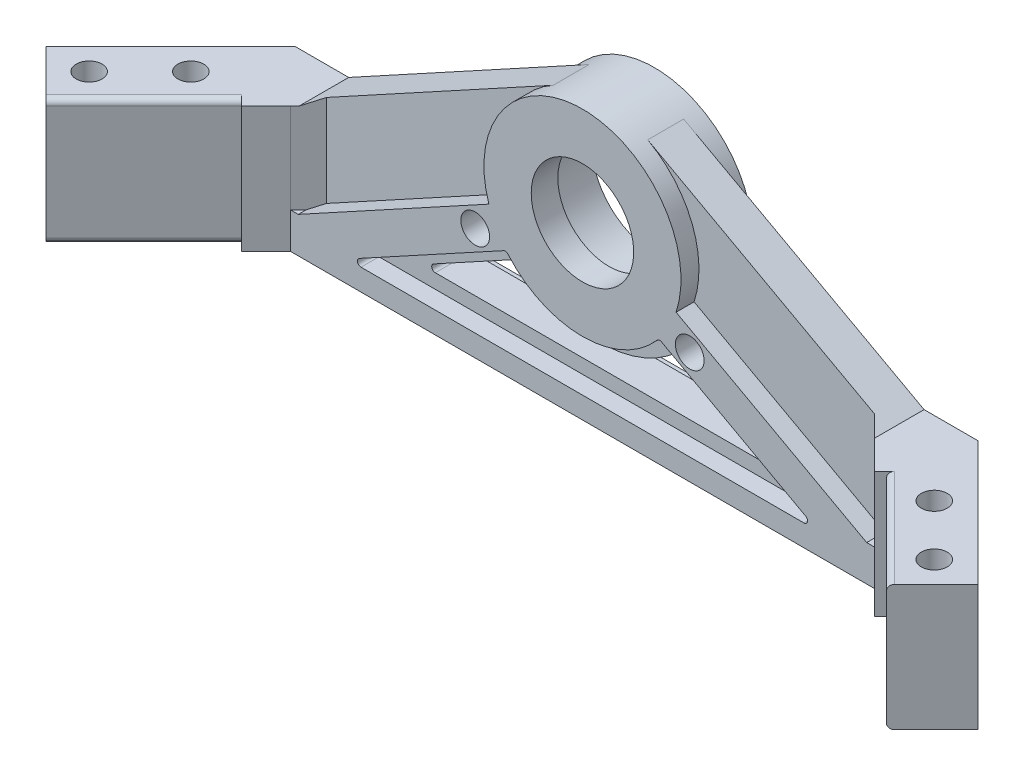
from build123d import *

# Parameters (mm, degrees)
BOSS_EXTRUDE1_DEPTH = 11.1125
BOSS_EXTRUDE2_DEPTH = 12.7
CUT_EXTRUDE2_DEPTH  = 8
CUT_EXTRUDE3_DEPTH  = 96.942967533
SKETCH5_W           = 25.144717139
SKETCH5_H           = 15.875
CUT_EXTRUDE4_DEPTH  = 3.175
CUT_EXTRUDE5_DEPTH  = 96.942967533
SKETCH6_R           = 2.54
CUT_EXTRUDE6_DEPTH  = 96.942967533
CUT_EXTRUDE7_START  = -3.175
CUT_EXTRUDE7_DEPTH  = 3.175
CHAMFER1_SIZE       = 3.175
FILLET1_R           = 0.635
FILLET3_R           = 1.016
SKETCH8_R           = 2.286
CUT_EXTRUDE8_DEPTH  = 93.295392221
CUT_EXTRUDE9_DEPTH  = 0.5


with BuildPart() as part:
    # Sketch3 → Boss-Extrude1 (new, symmetric)
    with BuildSketch(Plane(origin=(0, 0, 0), x_dir=(1, 0, 0), z_dir=(0, 1, 0))):
        Polygon((-56.934473853, -15.948934871), (-65.016704362, -7.866704362), (-82.294717139, -25.144717139), (-74.93090712, -32.508527158), (-74.21248663, -33.226947648), align=None)
        Polygon((-65.016704362, -7.866704362), (-55.873813681, -17.009595043), (-52.371513794, -13.507295156), (-61.514404475, -4.364404475), align=None)
        Polygon((-52.371513794, -13.507295156), (-51.564218639, -12.7), (-17.311249955, -12.7), (0, -12.7), (0, 0), (-17.311249955, 0), (-57.15, 0), (-60.325, -3.175), (-61.514404475, -4.364404475), align=None)
        Polygon((0, 0), (0, -12.7), (17.311249955, -12.7), (51.564218639, -12.7), (52.371513794, -13.507295156), (61.514404475, -4.364404475), (60.325, -3.175), (57.15, 0), (17.311249955, 0), align=None)
        Polygon((61.514404475, -4.364404475), (65.016704362, -7.866704362), (55.873813681, -17.009595043), (52.371513794, -13.507295156), align=None)
        Polygon((65.016704362, -7.866704362), (56.934473853, -15.948934871), (74.21248663, -33.226947648), (74.93090712, -32.508527158), (82.294717139, -25.144717139), align=None)
    extrude(amount=BOSS_EXTRUDE1_DEPTH, both=True)

    # Sketch2 → Boss-Extrude2 (add)
    with BuildSketch(Plane.XY):
        with BuildLine():
            Line((-50.804788276, 11.1125), (50.804788276, 11.1125))
            Line((50.804788276, 11.1125), (8.344749207, 34.318436746))
            ThreePointArc((8.344749207, 34.318436746), (0, 36.45), (-8.344749207, 34.318436746))
            Line((-8.344749207, 34.318436746), (-50.804788276, 11.1125))
        make_face()
    extrude(amount=BOSS_EXTRUDE2_DEPTH)

    # Sketch2<3> → Cut-Extrude2 (cut)
    with BuildSketch(Plane.XY):
        with BuildLine():
            ThreePointArc((0, 30.1), (-11.05, 19.05), (0, 8))
            Line((0, 8), (0, 10))
            ThreePointArc((0, 10), (-9.05, 19.05), (0, 28.1))
            Line((0, 28.1), (0, 30.1))
        make_face()
        with BuildLine():
            Line((0, 10), (0, 8))
            ThreePointArc((0, 8), (7.813529932, 11.236470068), (11.05, 19.05))
            ThreePointArc((11.05, 19.05), (7.813529932, 26.863529932), (0, 30.1))
            Line((0, 30.1), (0, 28.1))
            ThreePointArc((0, 28.1), (6.39931637, 25.44931637), (9.05, 19.05))
            ThreePointArc((9.05, 19.05), (6.39931637, 12.65068363), (0, 10))
        make_face()
        with BuildLine():
            ThreePointArc((0, 28.1), (-9.05, 19.05), (0, 10))
            Line((0, 10), (0, 28.1))
        make_face()
        with BuildLine():
            Line((0, 28.1), (0, 10))
            ThreePointArc((0, 10), (6.39931637, 12.65068363), (9.05, 19.05))
            ThreePointArc((9.05, 19.05), (6.39931637, 25.44931637), (0, 28.1))
        make_face()
    extrude(amount=CUT_EXTRUDE2_DEPTH, mode=Mode.SUBTRACT)

    # Sketch2<5> → Cut-Extrude3 (cut, through all)
    with BuildSketch(Plane.XY):
        with BuildLine():
            ThreePointArc((0, 28.1), (-9.05, 19.05), (0, 10))
            Line((0, 10), (0, 28.1))
        make_face()
        with BuildLine():
            Line((0, 28.1), (0, 10))
            ThreePointArc((0, 10), (6.39931637, 12.65068363), (9.05, 19.05))
            ThreePointArc((9.05, 19.05), (6.39931637, 25.44931637), (0, 28.1))
        make_face()
    extrude(amount=CUT_EXTRUDE3_DEPTH, mode=Mode.SUBTRACT)

    # Sketch5 → Cut-Extrude4 (cut)
    # profile 1 of 5: a face of its own
    with BuildSketch(Plane(origin=(0, 0, 0), x_dir=(-1, 0, 0), z_dir=(0, 0, -1))):
        with Locations((-69.72235857, 3.175)):
            Rectangle(SKETCH5_W, SKETCH5_H)
    # profile 2 of 5: a face of its own
    with BuildSketch(Plane(origin=(0, 0, 0), x_dir=(-1, 0, 0), z_dir=(0, 0, -1))):
        with BuildLine():
            Line((-50.190202202, -4.7625), (-16.534774751, 13.631400187))
            ThreePointArc((-16.534774751, 13.631400187), (-16.178258512, 25.454994263), (-8.344749207, 34.318436746))
            Line((-8.344749207, 34.318436746), (-50.804788276, 11.1125))
            Line((-50.804788276, 11.1125), (-57.15, 11.1125))
            Line((-57.15, 11.1125), (-57.15, -4.7625))
            Line((-57.15, -4.7625), (-50.190202202, -4.7625))
        make_face()
    # profile 3 of 5: a face of its own
    with BuildSketch(Plane(origin=(0, 0, 0), x_dir=(-1, 0, 0), z_dir=(0, 0, -1))):
        with BuildLine():
            Line((50.804788276, 11.1125), (8.344749207, 34.318436746))
            ThreePointArc((8.344749207, 34.318436746), (14.965938597, 27.925848236), (17.4, 19.05))
            ThreePointArc((17.4, 19.05), (17.182332215, 16.306378367), (16.534774751, 13.631400187))
            Line((16.534774751, 13.631400187), (50.190202202, -4.7625))
            Line((50.190202202, -4.7625), (57.15, -4.7625))
            Line((57.15, -4.7625), (57.15, 11.1125))
            Line((57.15, 11.1125), (50.804788276, 11.1125))
        make_face()
    # profile 4 of 5: a face of its own
    with BuildSketch(Plane(origin=(0, 0, 0), x_dir=(-1, 0, 0), z_dir=(0, 0, -1))):
        with Locations((69.72235857, 3.175)):
            Rectangle(SKETCH5_W, SKETCH5_H)
    # profile 5 of 5: a face of its own
    with BuildSketch(Plane(origin=(0, 0, 0), x_dir=(-1, 0, 0), z_dir=(0, 0, -1))):
        with BuildLine():
            ThreePointArc((13.489420874, 8.059298271), (0, 1.65), (-13.489420874, 8.059298271))
            Line((-13.489420874, 8.059298271), (-41.5969936, -7.3025))
            Line((-41.5969936, -7.3025), (41.5969936, -7.3025))
            Line((41.5969936, -7.3025), (13.489420874, 8.059298271))
        make_face()
        with BuildLine():
            Line((31.653276027, -4.7625), (-31.653276027, -4.7625))
            Line((-31.653276027, -4.7625), (-14.022402602, 4.873405723))
            ThreePointArc((-14.022402602, 4.873405723), (0, -0.89), (14.022402602, 4.873405723))
            Line((14.022402602, 4.873405723), (31.653276027, -4.7625))
        make_face(mode=Mode.SUBTRACT)
    extrude(amount=-CUT_EXTRUDE4_DEPTH, mode=Mode.SUBTRACT)

    # Sketch5<3> → Cut-Extrude5 (cut, through all)
    with BuildSketch(Plane(origin=(0, 0, 0), x_dir=(-1, 0, 0), z_dir=(0, 0, -1))):
        with BuildLine():
            ThreePointArc((-14.022402602, 4.873405723), (0, -0.89), (14.022402602, 4.873405723))
            Line((14.022402602, 4.873405723), (31.653276027, -4.7625))
            Line((31.653276027, -4.7625), (-31.653276027, -4.7625))
            Line((-31.653276027, -4.7625), (-14.022402602, 4.873405723))
        make_face()
    extrude(amount=-CUT_EXTRUDE5_DEPTH, mode=Mode.SUBTRACT)

    # Sketch6 → Cut-Extrude6 (cut, through all)
    with BuildSketch(Plane(origin=(0, 0, 0), x_dir=(-1, 0, 0), z_dir=(0, 0, -1))):
        with Locations((-18.945146514, 8.695796817)):
            Circle(SKETCH6_R)
        with Locations((18.945146514, 8.695796817)):
            Circle(SKETCH6_R)
    extrude(amount=-CUT_EXTRUDE6_DEPTH, mode=Mode.SUBTRACT)

    # Sketch7 → Cut-Extrude7 (cut)
    # profile 1 of 3: a face of its own
    with BuildSketch(Plane.XY.offset(12.7).offset(CUT_EXTRUDE7_START)):
        with BuildLine():
            ThreePointArc((13.489420874, 8.059298271), (0, 1.65), (-13.489420874, 8.059298271))
            Line((-13.489420874, 8.059298271), (-41.5969936, -7.3025))
            Line((-41.5969936, -7.3025), (41.5969936, -7.3025))
            Line((41.5969936, -7.3025), (13.489420874, 8.059298271))
        make_face()
        with BuildLine():
            Line((-31.653276027, -4.7625), (-14.022402602, 4.873405723))
            ThreePointArc((-14.022402602, 4.873405723), (0, -0.89), (14.022402602, 4.873405723))
            Line((14.022402602, 4.873405723), (31.653276027, -4.7625))
            Line((31.653276027, -4.7625), (-31.653276027, -4.7625))
        make_face(mode=Mode.SUBTRACT)
    # profile 2 of 3: a face of its own
    with BuildSketch(Plane.XY.offset(12.7).offset(CUT_EXTRUDE7_START)):
        with BuildLine():
            Line((-51.564218639, -4.7625), (-50.190202202, -4.7625))
            Line((-50.190202202, -4.7625), (-16.534774751, 13.631400187))
            ThreePointArc((-16.534774751, 13.631400187), (-16.178258512, 25.454994263), (-8.344749207, 34.318436746))
            Line((-8.344749207, 34.318436746), (-50.804788276, 11.1125))
            Line((-50.804788276, 11.1125), (-51.564218639, 11.1125))
            Line((-51.564218639, 11.1125), (-51.564218639, -4.7625))
        make_face()
    # profile 3 of 3: a face of its own
    with BuildSketch(Plane.XY.offset(12.7).offset(CUT_EXTRUDE7_START)):
        with BuildLine():
            Line((50.804788276, 11.1125), (8.344749207, 34.318436746))
            ThreePointArc((8.344749207, 34.318436746), (14.965938597, 27.925848236), (17.4, 19.05))
            ThreePointArc((17.4, 19.05), (17.182332215, 16.306378367), (16.534774751, 13.631400187))
            Line((16.534774751, 13.631400187), (50.190202202, -4.7625))
            Line((50.190202202, -4.7625), (51.564218639, -4.7625))
            Line((51.564218639, -4.7625), (51.564218639, 11.1125))
            Line((51.564218639, 11.1125), (50.804788276, 11.1125))
        make_face()
    extrude(amount=CUT_EXTRUDE7_DEPTH, mode=Mode.SUBTRACT)

    # Chamfer1
    # the kernel refuses this chamfer: 3.175 mm, written as the material it adds along each edge
    with BuildSketch(Plane(origin=(51.564218639, -4.7625, 9.525), x_dir=(0.027495876610585654, 0, 0.9996219169112968), z_dir=(0, 1, 0))) as chamfer1_piece_1_section:
        Polygon((CHAMFER1_SIZE * 0.999621916911, -CHAMFER1_SIZE * 0.0274958766106), (-CHAMFER1_SIZE * 0.0274958766106, -CHAMFER1_SIZE * 0.999621916911), (0, 0), align=None)
    chamfer1_piece_1 = extrude(amount=24.040093487, mode=Mode.PRIVATE)
    chamfer1_piece_1 = split(chamfer1_piece_1, bisect_by=Plane(origin=(53.914958876, 9.412680033, 10.585049919), z_dir=(-0.47958328775301867, -0.8774963647263762, 0)), keep=Keep.TOP, mode=Mode.PRIVATE)
    add(chamfer1_piece_1)
    with BuildSketch(Plane(origin=(51.564218639, -12.927593487, 9.525), x_dir=(0.027495876610585654, 0, 0.9996219169112968), z_dir=(0, 1, 0))) as chamfer1_piece_2_section:
        Polygon((CHAMFER1_SIZE * 0.999621916911, -CHAMFER1_SIZE * 0.0274958766106), (-CHAMFER1_SIZE * 0.0274958766106, -CHAMFER1_SIZE * 0.999621916911), (0, 0), align=None)
    chamfer1_piece_2 = extrude(amount=24.040093487, mode=Mode.PRIVATE)
    chamfer1_piece_2 = split(chamfer1_piece_2, bisect_by=Plane(origin=(51.262556983, 10.862312956, 10.991411226), z_dir=(0.47958328775301867, 0.8774963647263762, 0)), keep=Keep.TOP, mode=Mode.PRIVATE)
    add(chamfer1_piece_2)
    with BuildSketch(Plane(origin=(-51.564218639, 11.1125, 9.525), x_dir=(0.9996219169112966, 0, -0.02749587661058624), z_dir=(0, -1, 0))) as chamfer1_piece_3_section:
        Polygon((CHAMFER1_SIZE * 0.999621916911, CHAMFER1_SIZE * 0.0274958766106), (-CHAMFER1_SIZE * 0.0274958766106, CHAMFER1_SIZE * 0.999621916911), (0, 0), align=None)
    chamfer1_piece_3 = extrude(amount=24.040093487, mode=Mode.PRIVATE)
    chamfer1_piece_3 = split(chamfer1_piece_3, bisect_by=Plane(origin=(-44.440484715, -1.620072832, 10.991411226), z_dir=(-0.47958328775301895, 0.877496364726376, 0)), keep=Keep.TOP, mode=Mode.PRIVATE)
    add(chamfer1_piece_3)
    with BuildSketch(Plane(origin=(-51.564218639, 19.277593487, 9.525), x_dir=(0.9996219169112966, 0, -0.02749587661058624), z_dir=(0, -1, 0))) as chamfer1_piece_4_section:
        Polygon((CHAMFER1_SIZE * 0.999621916911, CHAMFER1_SIZE * 0.0274958766106), (-CHAMFER1_SIZE * 0.0274958766106, CHAMFER1_SIZE * 0.999621916911), (0, 0), align=None)
    chamfer1_piece_4 = extrude(amount=32.205186974, mode=Mode.PRIVATE)
    chamfer1_piece_4 = split(chamfer1_piece_4, bisect_by=Plane(origin=(-49.73589879, 11.696686504, 10.128892409), z_dir=(0.47958328775301867, -0.8774963647263762, 0)), keep=Keep.TOP, mode=Mode.PRIVATE)
    chamfer1_piece_4 = split(chamfer1_piece_4, bisect_by=Plane(origin=(-42.913826522, -0.785699284, 10.128892409), z_dir=(-0.47958328775301895, 0.877496364726376, 0)), keep=Keep.TOP, mode=Mode.PRIVATE)
    add(chamfer1_piece_4)
    with BuildSketch(Plane(origin=(-59.729312125, -4.7625, 9.525), x_dir=(0, 0.9996219169112968, -0.027495876610586195), z_dir=(1, 0, 0))) as chamfer1_piece_5_section:
        Polygon((CHAMFER1_SIZE * 0.999621916911, CHAMFER1_SIZE * 0.0274958766106), (-CHAMFER1_SIZE * 0.0274958766106, CHAMFER1_SIZE * 0.999621916911), (0, 0), align=None)
    chamfer1_piece_5 = extrude(amount=17.70420341, mode=Mode.PRIVATE)
    chamfer1_piece_5 = split(chamfer1_piece_5, bisect_by=Plane(origin=(-49.815745478, -3.522292213, 10.951526839), z_dir=(-0.7071067811865481, 0, -0.707106781186547)), keep=Keep.TOP, mode=Mode.PRIVATE)
    add(chamfer1_piece_5)

    # Fillet1
    fillet1_edges = [part.edges().sort_by_distance(p)[0] for p in [
        (13.489420874, 8.059298271, 1.5875),
        (-13.489420874, 8.059298271, 1.5875),
        (-41.5969936, -7.3025, 1.5875),
        (41.5969936, -7.3025, 1.5875),
        (14.022402602, 4.873405723, 6.35),
        (31.653276027, -4.7625, 6.35),
        (-31.653276027, -4.7625, 6.35),
        (-14.022402602, 4.873405723, 6.35),
        (-13.489420874, 8.059298271, 11.1125),
        (13.489420874, 8.059298271, 11.1125),
        (41.5969936, -7.3025, 11.1125),
        (-41.5969936, -7.3025, 11.1125),
    ]]
    fillet(fillet1_edges, radius=FILLET1_R)

    # Fillet3
    fillet3_edges = [part.edges().sort_by_distance(p)[0] for p in [
        (65.573480242, -11.1125, 24.587941259),
        (-65.573480242, -11.1125, 24.587941259),
        (65.573480242, 11.1125, 24.587941259),
        (-65.573480242, 11.1125, 24.587941259),
    ]]
    fillet(fillet3_edges, radius=FILLET3_R)

    # Sketch8 → Cut-Extrude8 (cut, through all)
    with BuildSketch(Plane(origin=(0, 11.1125, 0), x_dir=(1, 0, 0), z_dir=(0, 1, 0))):
        with Locations(Location((74.625578412, -25.198598676, 0), (0, 0, 270))):
            Circle(SKETCH8_R)
        with Locations(Location((-74.625578412, -25.198598676, 0), (0, 0, 270))):
            Circle(SKETCH8_R)
        with Locations(Location((65.645322291, -16.218342555, 0), (0, 0, 270))):
            Circle(SKETCH8_R)
        with Locations(Location((-65.645322291, -16.218342555, 0), (0, 0, 90))):
            Circle(SKETCH8_R)
    extrude(amount=-CUT_EXTRUDE8_DEPTH, mode=Mode.SUBTRACT)

    # Sketch9 → Cut-Extrude9 (cut)
    # profile 1 of 5: a face of its own
    with BuildSketch(Plane.XZ.offset(11.1125)):
        with BuildLine():
            Line((6.955128205, 5.655889423), (6.573717949, 5.452564103))
            add(Edge.make_bspline(
                [(6.573717949, 5.452564103), (6.545922437, 5.498605223), (6.492797515, 5.586602559), (6.405563696, 5.705145418), (6.318829653, 5.806231322), (6.231739217, 5.889758205), (6.143082637, 5.95438438), (6.053764997, 6.001091066), (5.963227276, 6.030447771), (5.9020118, 6.034100411), (5.871895032, 6.035897436)],
                knots=[0, 0, 0, 0, 1.354943589, 2.589672558, 3.704607527, 4.708856974, 5.624398268, 6.459549776, 7.242129862, 8, 8, 8, 8], degree=3))
            add(Edge.make_bspline(
                [(5.871895032, 6.035897436), (5.843777409, 6.034998249), (5.788084486, 6.03321722), (5.706289617, 6.017626176), (5.626860085, 5.99419681), (5.551935483, 5.959511514), (5.48244247, 5.918382044), (5.420674582, 5.869797955), (5.368082166, 5.814645054), (5.325239521, 5.753088186), (5.291507213, 5.688001962), (5.267412618, 5.620080583), (5.252956595, 5.549928839), (5.250989532, 5.502409986), (5.25, 5.478505609)],
                knots=[0, 0, 0, 0, 1.088711937, 2.156425153, 3.216543554, 4.290691142, 5.346933412, 6.339926723, 7.326538423, 8.288906172, 9.236802047, 10.159214894, 11.073992371, 12, 12, 12, 12], degree=3))
            add(Edge.make_bspline(
                [(5.25, 5.478505609), (5.251289441, 5.451237129), (5.253897944, 5.396073728), (5.277544855, 5.314729095), (5.312451573, 5.233254329), (5.346112616, 5.182849411), (5.363581731, 5.156690705)],
                knots=[0, 0, 0, 0, 0.942144539, 1.905933023, 2.913239343, 4, 4, 4, 4], degree=3))
            add(Edge.make_bspline(
                [(5.363581731, 5.156690705), (5.378599068, 5.137617448), (5.410211837, 5.097466622), (5.463771743, 5.037071303), (5.526108213, 4.973940726), (5.598480894, 4.909395911), (5.677065406, 4.839348386), (5.765885722, 4.768357575), (5.862751255, 4.693916401), (5.930689868, 4.644038805), (5.965845353, 4.618229167)],
                knots=[0, 0, 0, 0, 0.718605451, 1.5127255, 2.388525841, 3.34361075, 4.383114545, 5.504804886, 6.708837455, 8, 8, 8, 8], degree=3))
            add(Edge.make_bspline(
                [(5.965845353, 4.618229167), (6.00168954, 4.592171602), (6.070464497, 4.542174431), (6.167362407, 4.468878347), (6.254240814, 4.401295296), (6.3304335, 4.339372455), (6.395949126, 4.282571618), (6.450649678, 4.231125865), (6.496181868, 4.186447001), (6.520649569, 4.156384964), (6.531650641, 4.14286859)],
                knots=[0, 0, 0, 0, 1.435833971, 2.754963323, 3.936484598, 5.002077172, 5.935979083, 6.744956812, 7.435712417, 8, 8, 8, 8], degree=3))
            add(Edge.make_bspline(
                [(6.531650641, 4.14286859), (6.547710719, 4.122117406), (6.579262034, 4.081350037), (6.61920709, 4.015956536), (6.653578917, 3.949707187), (6.681889214, 3.881988561), (6.703827988, 3.813016997), (6.718920828, 3.742550617), (6.729567054, 3.670869327), (6.730367062, 3.622441786), (6.730769231, 3.598096955)],
                knots=[0, 0, 0, 0, 1.064105702, 2.090521257, 3.104283852, 4.09061442, 5.065433238, 6.036507983, 7.012940167, 8, 8, 8, 8], degree=3))
            add(Edge.make_bspline(
                [(6.730769231, 3.598096955), (6.729515083, 3.560126606), (6.727031963, 3.484948093), (6.704399939, 3.375068313), (6.668607851, 3.26994227), (6.617838539, 3.171328353), (6.554959306, 3.080088965), (6.479870762, 2.998403207), (6.392434284, 2.927813249), (6.294689139, 2.868139824), (6.189328785, 2.819749269), (6.078360338, 2.785257467), (5.963128198, 2.764347606), (5.884835503, 2.761630248), (5.845252404, 2.76025641)],
                knots=[0, 0, 0, 0, 1.004538361, 1.98891246, 2.957754601, 3.937604432, 4.916182936, 5.884154884, 6.865254872, 7.882148152, 8.909646262, 9.927556077, 10.952217026, 12, 12, 12, 12], degree=3))
            add(Edge.make_bspline(
                [(5.845252404, 2.76025641), (5.800288489, 2.761765646), (5.711198198, 2.764756006), (5.58029896, 2.787799883), (5.45446477, 2.825234465), (5.353568286, 2.868466228), (5.275055104, 2.912290321), (5.215686682, 2.951924562), (5.154833361, 2.996764375), (5.09442727, 3.049062555), (5.032112714, 3.106283691), (4.9710811, 3.171539686), (4.907469941, 3.241090211), (4.86692652, 3.291248304), (4.846153846, 3.316947115)],
                knots=[0, 0, 0, 0, 1.360687177, 2.696028959, 4.010076158, 5.328383209, 6.009416266, 6.72960499, 7.488083515, 8.296188009, 9.147227534, 10.04798982, 10.999875445, 12, 12, 12, 12], degree=3))
            Line((4.846153846, 3.316947115), (5.212139423, 3.567948718))
            add(Edge.make_bspline(
                [(5.212139423, 3.567948718), (5.231197788, 3.547515179), (5.267953877, 3.508106922), (5.322642771, 3.45291865), (5.373784064, 3.403079657), (5.421450494, 3.358595495), (5.466336542, 3.319984295), (5.508000192, 3.286910753), (5.546973362, 3.260282729), (5.593160244, 3.230943128), (5.651920246, 3.204105222), (5.723895671, 3.180794058), (5.798937681, 3.16714817), (5.849638961, 3.165128681), (5.875400641, 3.164102564)],
                knots=[0, 0, 0, 0, 1.253255604, 2.417037033, 3.484535688, 4.456276324, 5.340879413, 6.139846054, 6.840628373, 7.457335203, 8.592193832, 9.725986821, 10.844557802, 12, 12, 12, 12], degree=3))
            add(Edge.make_bspline(
                [(5.875400641, 3.164102564), (5.902885124, 3.165396572), (5.956317203, 3.167912228), (6.032932005, 3.189110321), (6.103119698, 3.223200893), (6.165194449, 3.27097975), (6.217718177, 3.329639699), (6.255574284, 3.399162998), (6.277829561, 3.478036176), (6.280604327, 3.533445496), (6.282051282, 3.562339744)],
                knots=[0, 0, 0, 0, 1.033786987, 2.00976631, 2.970458119, 3.95651055, 4.942051941, 5.915168215, 6.91282465, 8, 8, 8, 8], degree=3))
            add(Edge.make_bspline(
                [(6.282051282, 3.562339744), (6.28149088, 3.581062134), (6.28037143, 3.618461629), (6.272009308, 3.67382967), (6.256922644, 3.72753238), (6.23645815, 3.780017787), (6.209395004, 3.831703254), (6.175597302, 3.882906129), (6.134357789, 3.933943781), (6.102846717, 3.966210779), (6.086438301, 3.983012821)],
                knots=[0, 0, 0, 0, 0.941102048, 1.879927795, 2.806320176, 3.740133313, 4.70706341, 5.733547381, 6.819814909, 8, 8, 8, 8], degree=3))
            add(Edge.make_bspline(
                [(6.086438301, 3.983012821), (6.078121626, 3.990836739), (6.059033112, 4.008794272), (6.024022728, 4.036292581), (5.981368032, 4.070768116), (5.930477678, 4.111658174), (5.869678278, 4.156742774), (5.801217798, 4.209033937), (5.723362816, 4.266177574), (5.668576046, 4.306239142), (5.639823718, 4.327263622)],
                knots=[0, 0, 0, 0, 0.485581606, 1.114511607, 1.892484918, 2.819534315, 3.891398566, 5.11240712, 6.484579029, 8, 8, 8, 8], degree=3))
            add(Edge.make_bspline(
                [(5.639823718, 4.327263622), (5.600647247, 4.355810699), (5.524859001, 4.411036014), (5.417274927, 4.494420765), (5.320111394, 4.575739513), (5.231859623, 4.653699656), (5.153297125, 4.728862304), (5.085159515, 4.802258672), (5.025718972, 4.871778844), (4.962356185, 4.960505052), (4.898616052, 5.06962878), (4.843298524, 5.202280536), (4.808089766, 5.335069751), (4.80353079, 5.424082684), (4.801282051, 5.467988782)],
                knots=[0, 0, 0, 0, 1.186639563, 2.29559556, 3.331401308, 4.287832086, 5.178002532, 5.991653193, 6.738845359, 7.415240842, 8.658551622, 9.823054859, 10.926210341, 12, 12, 12, 12], degree=3))
            add(Edge.make_bspline(
                [(4.801282051, 5.467988782), (4.802275506, 5.499122385), (4.804250073, 5.561002801), (4.818566607, 5.652496737), (4.842387021, 5.741426577), (4.876660762, 5.827412615), (4.919396348, 5.91127786), (4.972439298, 5.992227342), (5.035257903, 6.070059394), (5.106262482, 6.144446648), (5.183899032, 6.213576047), (5.267788427, 6.274099775), (5.356348148, 6.325831589), (5.450294329, 6.366808857), (5.548106527, 6.400426022), (5.651087312, 6.423387681), (5.758665045, 6.436656939), (5.831894176, 6.438703864), (5.869090545, 6.43974359)],
                knots=[0, 0, 0, 0, 0.932738639, 1.853889356, 2.767877299, 3.686041414, 4.622558463, 5.584089528, 6.580490983, 7.61578374, 8.662665956, 9.690923261, 10.710750907, 11.729736566, 12.757349726, 13.805636525, 14.885384091, 16, 16, 16, 16], degree=3))
            add(Edge.make_bspline(
                [(5.869090545, 6.43974359), (5.896214412, 6.439141134), (5.949637214, 6.437954545), (6.028947511, 6.430427802), (6.106126309, 6.415961477), (6.181596753, 6.397257975), (6.255405946, 6.373441591), (6.326602693, 6.34297607), (6.396372582, 6.307982208), (6.464315382, 6.267008021), (6.530517733, 6.219030474), (6.595355852, 6.163337979), (6.658453112, 6.09895153), (6.720891134, 6.026707642), (6.781845028, 5.945793723), (6.841172492, 5.856635242), (6.899631031, 5.759519711), (6.936264526, 5.691113712), (6.955128205, 5.655889423)],
                knots=[0, 0, 0, 0, 0.916943493, 1.805999526, 2.689245248, 3.568702553, 4.433092864, 5.307568578, 6.183755457, 7.069823058, 7.986358083, 8.944343836, 9.955449961, 11.030835633, 12.170024038, 13.377301724, 14.649494474, 16, 16, 16, 16], degree=3))
        make_face()
    # profile 2 of 5: a face of its own
    with BuildSketch(Plane.XZ.offset(11.1125)):
        Polygon((4.128205128, 6.35), (4.128205128, 2.85), (3.962039263, 2.85), (1.83974359, 5.509354968), (1.83974359, 2.85), (1.391025641, 2.85), (1.391025641, 6.35), (1.574719551, 6.35), (3.679487179, 3.69765625), (3.679487179, 6.35), align=None)
    # profile 3 of 5: a face of its own
    with BuildSketch(Plane.XZ.offset(11.1125)):
        Polygon((0.043469551, 2.85), (-0.717948718, 2.85), (-0.717948718, 6.35), (-0.269230769, 6.35), (-0.269230769, 3.253846154), (0.269230769, 3.253846154), align=None)
    # profile 4 of 5: a face of its own
    with BuildSketch(Plane.XZ.offset(11.1125)):
        with BuildLine():
            add(Edge.make_bspline(
                [(-1.929487179, 4.601402244), (-1.929820024, 4.545772786), (-1.930466421, 4.437738209), (-1.937473576, 4.280579568), (-1.949475503, 4.133047998), (-1.965186437, 3.99497525), (-1.985981936, 3.866455085), (-2.01210377, 3.747657913), (-2.041666608, 3.638070524), (-2.077057072, 3.537721733), (-2.116884293, 3.445335588), (-2.159279173, 3.358445926), (-2.207248145, 3.277982304), (-2.258445983, 3.202763868), (-2.313138476, 3.132633266), (-2.372968524, 3.069102006), (-2.436199286, 3.01043296), (-2.503346552, 2.957979374), (-2.573759685, 2.911897493), (-2.645716894, 2.870677498), (-2.720506077, 2.837466064), (-2.796608784, 2.808773511), (-2.875043288, 2.787234356), (-2.955710335, 2.771953379), (-3.038153153, 2.761483068), (-3.094018037, 2.760666707), (-3.122095353, 2.76025641)],
                knots=[0, 0, 0, 0, 1.622605109, 3.151162473, 4.587442309, 5.939538287, 7.20372481, 8.383107478, 9.486239959, 10.512528934, 11.483748244, 12.419707751, 13.330476935, 14.213498841, 15.072700274, 15.92158999, 16.756207925, 17.586695167, 18.403499641, 19.2093348, 20.002585959, 20.787710657, 21.579935901, 22.371427536, 23.181490415, 24, 24, 24, 24], degree=3))
            add(Edge.make_bspline(
                [(-3.122095353, 2.76025641), (-3.152731517, 2.761033674), (-3.213201864, 2.762567854), (-3.302787896, 2.771651823), (-3.389864801, 2.78757717), (-3.474185977, 2.81134458), (-3.556619955, 2.83954235), (-3.63604835, 2.875891171), (-3.713266346, 2.917848905), (-3.787678328, 2.966252878), (-3.858415308, 3.020964068), (-3.925441203, 3.081687718), (-3.988267508, 3.148014653), (-4.046907915, 3.220326578), (-4.101416121, 3.2977732), (-4.151425746, 3.381374377), (-4.197578861, 3.470324753), (-4.240034798, 3.565409639), (-4.277149587, 3.667580194), (-4.309407109, 3.777408534), (-4.336484753, 3.895211611), (-4.358892888, 4.021105793), (-4.376144672, 4.154950988), (-4.388881636, 4.296670021), (-4.395532446, 4.44639057), (-4.396790125, 4.548812409), (-4.397435897, 4.601402244)],
                knots=[0, 0, 0, 0, 0.874832558, 1.726764085, 2.568361456, 3.398879789, 4.226201588, 5.053523386, 5.889679481, 6.733707388, 7.585299078, 8.4404393, 9.313717912, 10.191269597, 11.096596538, 12.015593249, 12.970707924, 13.956566593, 14.986800884, 16.072143337, 17.223061702, 18.436511454, 19.721974523, 21.075312687, 22.498281019, 24, 24, 24, 24], degree=3))
            add(Edge.make_bspline(
                [(-4.397435897, 4.601402244), (-4.396782502, 4.653757336), (-4.395510127, 4.755709971), (-4.388966535, 4.904744814), (-4.375857992, 5.045682145), (-4.359906802, 5.178975556), (-4.336868841, 5.303968911), (-4.311081981, 5.421313071), (-4.278377775, 5.530191748), (-4.241956283, 5.631910666), (-4.200730937, 5.726917543), (-4.153785212, 5.815343618), (-4.104592007, 5.899021968), (-4.050060208, 5.976726285), (-3.991471708, 6.048656628), (-3.928478795, 6.115269439), (-3.861485674, 6.17603404), (-3.790212069, 6.231128369), (-3.715479627, 6.279794991), (-3.638364874, 6.322876937), (-3.558372006, 6.358984162), (-3.47592898, 6.388001652), (-3.391043214, 6.411839285), (-3.303435357, 6.427402676), (-3.213482705, 6.437646554), (-3.152739512, 6.439040408), (-3.122095353, 6.43974359)],
                knots=[0, 0, 0, 0, 1.49659969, 2.914373258, 4.262463443, 5.541784011, 6.749918813, 7.89402581, 8.97408983, 9.996834451, 10.981022981, 11.93120719, 12.856888794, 13.753851156, 14.64171265, 15.506454614, 16.371918745, 17.224394982, 18.078544691, 18.918788586, 19.746969722, 20.583674387, 21.415055378, 22.264095942, 23.124258755, 24, 24, 24, 24], degree=3))
            add(Edge.make_bspline(
                [(-3.122095353, 6.43974359), (-3.09379246, 6.439262863), (-3.037736562, 6.438310748), (-2.954962623, 6.428966204), (-2.874322736, 6.413472536), (-2.796083047, 6.391704526), (-2.719785436, 6.364330767), (-2.645951414, 6.33048748), (-2.574212715, 6.290386167), (-2.504974112, 6.244015703), (-2.438313207, 6.192389521), (-2.375492482, 6.134420479), (-2.316719786, 6.07040235), (-2.26121611, 6.000976337), (-2.209744799, 5.925591128), (-2.163065245, 5.843940476), (-2.119409324, 5.756680398), (-2.07933584, 5.66314306), (-2.043193198, 5.562154409), (-2.012518016, 5.452245215), (-1.986781079, 5.333047342), (-1.966139854, 5.20450334), (-1.949205111, 5.067012571), (-1.937551448, 4.920113235), (-1.930454678, 4.763900402), (-1.929815614, 4.656565118), (-1.929487179, 4.601402244)],
                knots=[0, 0, 0, 0, 0.826227461, 1.636402404, 2.428761462, 3.221854935, 4.005495932, 4.793404576, 5.590831925, 6.402844393, 7.224663165, 8.050552332, 8.895728592, 9.760111832, 10.644101474, 11.558317463, 12.504453911, 13.491971134, 14.528097073, 15.634271589, 16.821614375, 18.087186367, 19.434798266, 20.865849934, 22.389264722, 24, 24, 24, 24], degree=3))
        make_face()
        with BuildLine():
            add(Edge.make_bspline(
                [(-2.378205128, 4.6), (-2.378419726, 4.646978143), (-2.378835172, 4.737924313), (-2.383553365, 4.869584142), (-2.392507878, 4.992010362), (-2.402014458, 5.10560144), (-2.417187446, 5.210052574), (-2.43417632, 5.305659219), (-2.455212435, 5.392009987), (-2.479161501, 5.469956862), (-2.506024847, 5.540860229), (-2.535825564, 5.606139939), (-2.566716304, 5.667314607), (-2.601696035, 5.722840453), (-2.637826639, 5.774385586), (-2.677248131, 5.820847469), (-2.719335124, 5.862303347), (-2.777555397, 5.909959052), (-2.852043249, 5.959857009), (-2.944753063, 6.00300953), (-3.038190548, 6.031176958), (-3.101340061, 6.03433403), (-3.132612179, 6.035897436)],
                knots=[0, 0, 0, 0, 1.565050911, 3.029821469, 4.387792543, 5.654509782, 6.826079957, 7.902709307, 8.888453275, 9.784884885, 10.617798265, 11.412307314, 12.174931846, 12.898730956, 13.596561216, 14.270483471, 14.92565982, 15.561680851, 16.775288496, 17.900403612, 18.96026391, 20, 20, 20, 20], degree=3))
            add(Edge.make_bspline(
                [(-3.132612179, 6.035897436), (-3.168054227, 6.034058471), (-3.238491124, 6.030403744), (-3.34261479, 6.00330136), (-3.442241405, 5.957590126), (-3.521609932, 5.906501163), (-3.581382078, 5.856874548), (-3.624246304, 5.8146102), (-3.66449279, 5.768073914), (-3.701752084, 5.716682081), (-3.735741366, 5.660292891), (-3.768453883, 5.600087809), (-3.796952303, 5.534691513), (-3.813420097, 5.489117655), (-3.821814904, 5.465885417)],
                knots=[0, 0, 0, 0, 1.332284016, 2.647757677, 4.016941371, 5.440902831, 6.183743781, 6.935888695, 7.702483601, 8.495487208, 9.320161261, 10.177499591, 11.070941831, 12, 12, 12, 12], degree=3))
            add(Edge.make_bspline(
                [(-3.821814904, 5.465885417), (-3.831929041, 5.435361862), (-3.85254741, 5.373137481), (-3.878379392, 5.276258244), (-3.899765093, 5.174602806), (-3.918179373, 5.068712538), (-3.932161364, 4.95805397), (-3.941825857, 4.842733688), (-3.947369549, 4.722750985), (-3.948263486, 4.641371816), (-3.948717949, 4.6)],
                knots=[0, 0, 0, 0, 0.877617242, 1.789083553, 2.735016418, 3.71249782, 4.722174671, 5.778575778, 6.870664861, 8, 8, 8, 8], degree=3))
            add(Edge.make_bspline(
                [(-3.948717949, 4.6), (-3.948608725, 4.558624069), (-3.948395719, 4.477934078), (-3.94209743, 4.359902323), (-3.934450595, 4.247559434), (-3.921345323, 4.141010587), (-3.906323118, 4.040122019), (-3.88762759, 3.944993441), (-3.86425341, 3.856240158), (-3.8386314, 3.772957339), (-3.808880154, 3.695983195), (-3.777431111, 3.62396806), (-3.743341134, 3.557627664), (-3.706562256, 3.496727767), (-3.667551009, 3.441112765), (-3.625087361, 3.391371184), (-3.581383507, 3.346161322), (-3.519748428, 3.295331926), (-3.439673756, 3.243599562), (-3.339527163, 3.197463773), (-3.236699524, 3.169660171), (-3.167126865, 3.16594543), (-3.132612179, 3.164102564)],
                knots=[0, 0, 0, 0, 1.352790526, 2.638168002, 3.864385692, 5.034146782, 6.147421261, 7.199576936, 8.202392153, 9.147488116, 10.047345819, 10.899361637, 11.716276266, 12.484327605, 13.224378387, 13.934792477, 14.621120528, 15.277699797, 16.543226194, 17.726613715, 18.872183198, 20, 20, 20, 20], degree=3))
            add(Edge.make_bspline(
                [(-3.132612179, 3.164102564), (-3.101339883, 3.165675934), (-3.037964587, 3.16886447), (-2.94442002, 3.196995009), (-2.851470398, 3.239173971), (-2.777333691, 3.288883), (-2.719393381, 3.336106603), (-2.677871857, 3.377736352), (-2.639393929, 3.424685422), (-2.60210402, 3.475253981), (-2.568451882, 3.531748057), (-2.536289512, 3.592202677), (-2.506803475, 3.657781758), (-2.479852598, 3.728630034), (-2.455862309, 3.806581762), (-2.435063373, 3.893245794), (-2.4167274, 3.988867426), (-2.403286812, 4.093823841), (-2.392094758, 4.207456057), (-2.38369602, 4.330196594), (-2.378797858, 4.46207185), (-2.378407017, 4.55302055), (-2.378205128, 4.6)],
                knots=[0, 0, 0, 0, 1.039553373, 2.106721005, 3.228374519, 4.430983397, 5.066892657, 5.71642622, 6.385219945, 7.087472665, 7.807071781, 8.573169906, 9.367539334, 10.200306343, 11.096580419, 12.082151159, 13.167672988, 14.337976248, 15.605212313, 16.970710972, 18.435224121, 20, 20, 20, 20], degree=3))
        make_face(mode=Mode.SUBTRACT)
    # profile 5 of 5: a face of its own
    with BuildSketch(Plane.XZ.offset(11.1125)):
        Polygon((-5.430889423, 2.85), (-6.192307692, 2.85), (-6.192307692, 6.35), (-5.743589744, 6.35), (-5.743589744, 3.253846154), (-5.205128205, 3.253846154), align=None)
    extrude(amount=-CUT_EXTRUDE9_DEPTH, mode=Mode.SUBTRACT)


solid = part.part
